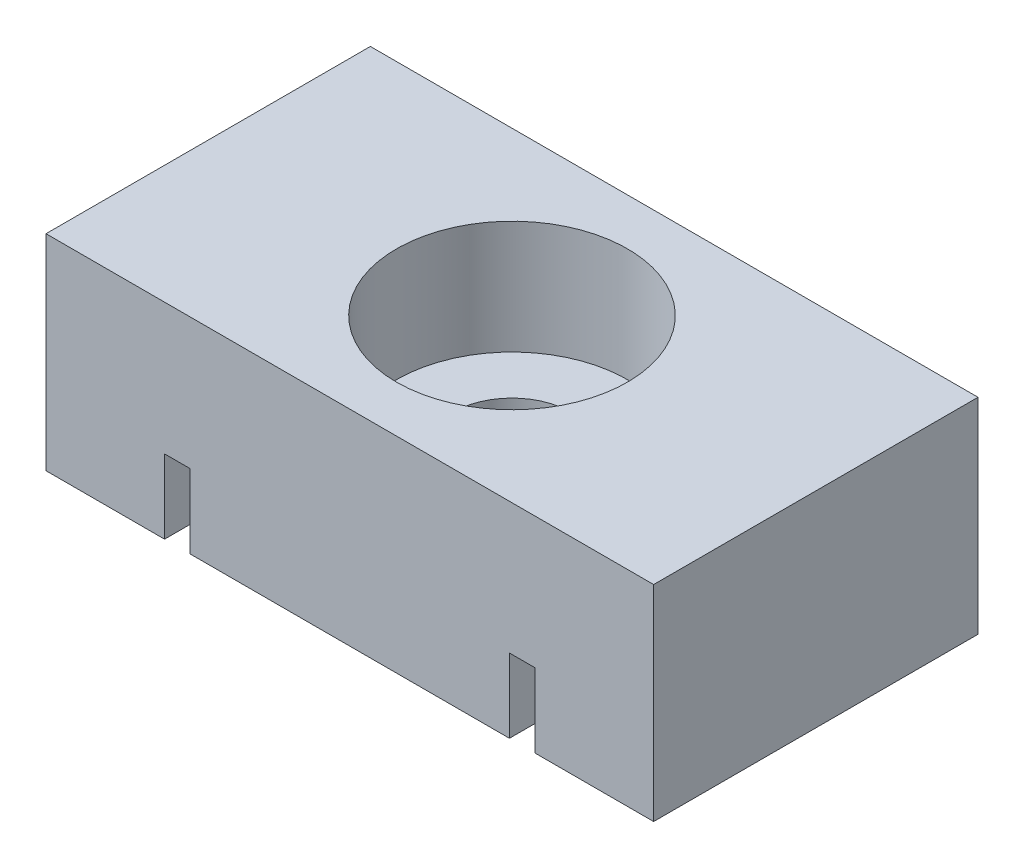
from build123d import *

# Parameters (mm, degrees)
SKETCH1_W               = 18.796
SKETCH1_H               = 10.033
BASE_DEPTH              = 6.35
BOXSLOTS_DEPTH          = 2.286
MOUTINGHOLE_D           = 3.6576
MOUTINGHOLE_CBORE_D     = 7.14502
MOUTINGHOLE_CBORE_DEPTH = 3.5052


with BuildPart() as part:
    # Sketch1 → Base (new body)
    with BuildSketch(Plane(origin=(0, 0, 0), x_dir=(1, 0, 0), z_dir=(0, 1, 0))):
        Rectangle(SKETCH1_W, SKETCH1_H)
    extrude(amount=BASE_DEPTH)

    # Sketch2 → BoxSlots (cut)
    with BuildSketch(Plane.XZ):
        with BuildLine():
            Line((-4.937125, 5.0165), (-4.937125, 3.5433))
            ThreePointArc((-4.937125, 3.5433), (-5.334, 3.146425), (-5.730875, 3.5433))
            Line((-5.730875, 3.5433), (-5.730875, 5.0165))
            ThreePointArc((-5.730875, 5.0165), (-5.334, 5.413375), (-4.937125, 5.0165))
        make_face()
        with BuildLine():
            Line((5.730875, 5.0165), (5.730875, 3.5433))
            ThreePointArc((5.730875, 3.5433), (5.334, 3.146425), (4.937125, 3.5433))
            Line((4.937125, 3.5433), (4.937125, 5.0165))
            ThreePointArc((4.937125, 5.0165), (5.334, 5.413375), (5.730875, 5.0165))
        make_face()
    extrude(amount=-BOXSLOTS_DEPTH, mode=Mode.SUBTRACT)

    # MoutingHole (through all)
    with Locations(Plane(origin=(0, 6.35, 0), x_dir=(1, 0, 0), z_dir=(0, 1, 0))):
        with Locations((0, 0)):
            CounterBoreHole(MOUTINGHOLE_D / 2, MOUTINGHOLE_CBORE_D / 2, MOUTINGHOLE_CBORE_DEPTH)


solid = part.part
